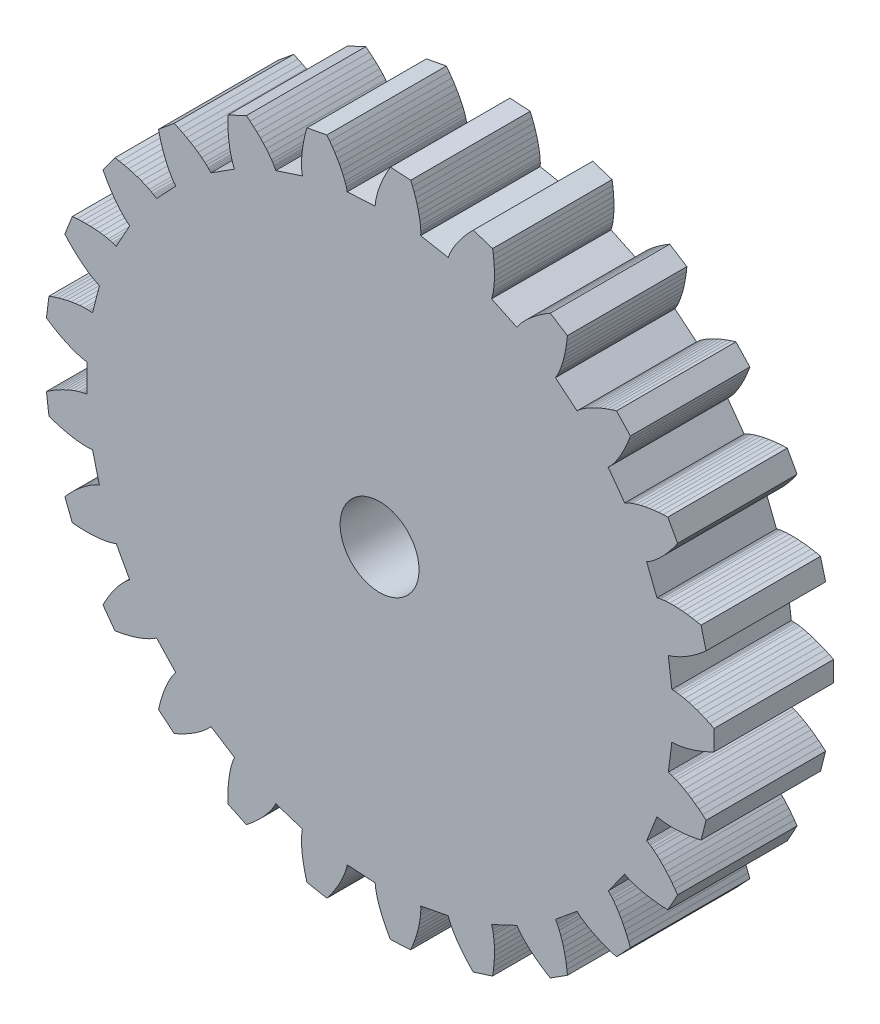
from build123d import *

# Parameters (mm, degrees)
MODEL_R             = 1.32
BOSS_EXTRUDE1_DEPTH = 4


with BuildPart() as part:
    # Model → Boss-Extrude1 (new body)
    with BuildSketch(Plane.XY):
        Polygon((22.5153116, 13.49371), (22.5501244, 13.4944492), (22.5850516, 13.4935692), (22.6200756, 13.4916244), (22.6551524, 13.4887996), (22.7254732, 13.4809588), (22.7959612, 13.4705748), (22.9373156, 13.4433212), (23.0790396, 13.4084996), (23.2209836, 13.3669196), (23.3630332, 13.319118), (23.5050916, 13.2654556), (23.6470444, 13.2062052), (23.7888124, 13.1415956), (23.93029, 13.071794), (23.93029, 12.391466), (23.7888124, 12.3216644), (23.6470444, 12.257046), (23.5050916, 12.1978044), (23.3630332, 12.144142), (23.2209836, 12.0963316), (23.0790396, 12.0547516), (22.9373156, 12.01993), (22.7959612, 11.9926764), (22.7254732, 11.9822924), (22.6551524, 11.9744516), (22.6200756, 11.9716356), (22.5850516, 11.969682), (22.5501244, 11.9688108), (22.5153116, 11.96955), (22.397462, 11.036662), (22.4313596, 11.0287244), (22.4649756, 11.0191852), (22.4984068, 11.00859), (22.5316884, 10.9971324), (22.5978468, 10.9720524), (22.6635388, 10.9444644), (22.7936732, 10.8829084), (22.9222852, 10.8139428), (23.0494276, 10.7383684), (23.1751356, 10.6567396), (23.299374, 10.569426), (23.4221428, 10.4767444), (23.5433804, 10.378906), (23.6630604, 10.2761132), (23.4938716, 9.6171516), (23.3394756, 9.5847324), (23.1860916, 9.5574084), (23.0338604, 9.5353204), (22.8829228, 9.5186708), (22.733446, 9.5076972), (22.5856236, 9.5027252), (22.4396932, 9.5042388), (22.295998, 9.5129948), (22.2251404, 9.5204748), (22.1550836, 9.5303572), (22.1204028, 9.53635), (22.0860036, 9.5431788), (22.0519476, 9.5510108), (22.0184196, 9.5603828), (21.6722716, 8.6861204), (21.7031332, 8.6699988), (21.7333172, 8.6523988), (21.76307, 8.633822), (21.7924532, 8.6144532), (21.8502868, 8.5737004), (21.9070556, 8.530642), (22.0178036, 8.4386644), (22.1252164, 8.3398756), (22.2295756, 8.2350588), (22.331022, 8.1247332), (22.4296524, 8.0092684), (22.5255108, 7.8889636), (22.6186148, 7.7640476), (22.7089732, 7.634714), (22.3812172, 7.0385404), (22.2236092, 7.0455364), (22.068254, 7.0572052), (21.91531, 7.0736788), (21.7649708, 7.0950892), (21.6174652, 7.12163), (21.4730484, 7.153574), (21.3320812, 7.1913348), (21.195074, 7.2355548), (21.1283084, 7.2604148), (21.0629068, 7.2874132), (21.0308044, 7.3018452), (20.999186, 7.3170076), (20.9681484, 7.3330676), (20.9379996, 7.3504828), (20.3853068, 6.5897668), (20.4111876, 6.566482), (20.4360564, 6.5419212), (20.4602476, 6.5165332), (20.4838844, 6.4904676), (20.5297764, 6.4366116), (20.5740492, 6.3807932), (20.6584412, 6.264158), (20.737914, 6.1417588), (20.8129252, 6.014282), (20.8837564, 5.882194), (20.950566, 5.7458292), (21.0134948, 5.6054604), (21.0726132, 5.4613164), (21.1279652, 5.313582), (20.6622428, 4.8176404), (20.5113228, 4.8636116), (20.3637556, 4.9135604), (20.2197172, 4.9675484), (20.0794276, 5.0256724), (19.9431508, 5.0880556), (19.8112124, 5.154918), (19.6840612, 5.22655), (19.562366, 5.3034532), (19.5038724, 5.3441356), (19.4472444, 5.3865516), (19.4197444, 5.4085076), (19.392878, 5.431062), (19.3668124, 5.454338), (19.3419436, 5.4787052), (18.6174308, 4.8793372), (18.6367116, 4.8503412), (18.65469, 4.8203684), (18.671806, 4.789762), (18.6882268, 4.7586364), (18.7192732, 4.6950564), (18.748278, 4.6299804), (18.8010076, 4.4960268), (18.8475508, 4.3577084), (18.888506, 4.2155796), (18.9242516, 4.0700276), (18.9550604, 3.921334), (18.9810996, 3.7697276), (19.00251, 3.6154108), (19.0193796, 3.4585508), (18.4449596, 3.0940108), (18.310214, 3.1760708), (18.1797012, 3.2611404), (18.0536148, 3.3492548), (17.9321836, 3.4404404), (17.8157068, 3.5347676), (17.7045452, 3.6323332), (17.5992092, 3.7333396), (17.5004468, 3.838086), (17.4539124, 3.8920388), (17.4096132, 3.947206), (17.3884316, 3.9753132), (17.3680332, 4.003834), (17.3485676, 4.0328564), (17.3305364, 4.0626444), (16.4797348, 3.6622884), (16.4911924, 3.6294116), (16.501154, 3.59591), (16.5101212, 3.5620124), (16.5182788, 3.5277716), (16.5325524, 3.4584716), (16.5444588, 3.38823), (16.5622172, 3.2453708), (16.5729004, 3.0998188), (16.5772212, 2.9519788), (16.575646, 2.802106), (16.5685092, 2.6504204), (16.5560308, 2.497098), (16.5383868, 2.342306), (16.515718, 2.1861764), (15.8686892, 1.9759444), (15.7585836, 2.0889364), (15.6533268, 2.203794), (15.5531124, 2.3204996), (15.458178, 2.439018), (15.368814, 2.5593404), (15.2854076, 2.6814932), (15.2084956, 2.8055204), (15.1388964, 2.9315364), (15.107234, 2.9953628), (15.0780444, 3.059814), (15.0645276, 3.0923036), (15.0518556, 3.1250044), (15.040222, 3.1579604), (15.0301724, 3.1912948), (14.1065244, 3.0151012), (14.1094548, 2.9804116), (14.110766, 2.9454844), (14.1110212, 2.9104164), (14.110414, 2.8752252), (14.1069996, 2.8045612), (14.1010596, 2.733554), (14.082738, 2.5907652), (14.0568836, 2.4471404), (14.024306, 2.3028644), (13.9855068, 2.1580868), (13.9408732, 2.0129484), (13.8906516, 1.867546), (13.8350708, 1.7220028), (13.7742892, 1.5764156), (13.0953076, 1.5337004), (13.0167588, 1.6705228), (12.9433668, 1.8079524), (12.8753252, 1.94591), (12.8128452, 2.0843076), (12.7562172, 2.2230836), (12.7058108, 2.3621324), (12.662154, 2.5013924), (12.6260828, 2.640758), (12.61129, 2.710454), (12.5990492, 2.7801412), (12.5940332, 2.8149716), (12.5898884, 2.849802), (12.5868172, 2.8846148), (12.585374, 2.9194012), (11.6469332, 2.9784404), (11.641134, 2.9441116), (11.6337244, 2.9099588), (11.62525, 2.8759292), (11.6159044, 2.8419964), (11.5950308, 2.7743948), (11.5716228, 2.7071012), (11.5183564, 2.57335), (11.4576012, 2.4406636), (11.390158, 2.3090244), (11.3165812, 2.17845), (11.2372492, 2.0489668), (11.1524524, 1.9206276), (11.0624196, 1.7934764), (10.9673444, 1.6675836), (10.2990636, 1.7950604), (10.2570084, 1.9471156), (10.22011, 2.0984756), (10.188518, 2.249026), (10.1624172, 2.3986172), (10.1420716, 2.5471084), (10.1278332, 2.6943324), (10.120186, 2.8400692), (10.1199044, 2.9840284), (10.122914, 3.0552116), (10.1283788, 3.1257524), (10.1321804, 3.1607412), (10.1368356, 3.1955012), (10.1425204, 3.2299884), (10.1497628, 3.2640444), (9.2554892, 3.5546116), (9.2413388, 3.5227996), (9.225666, 3.4915596), (9.2089988, 3.4607068), (9.1915132, 3.430162), (9.154474, 3.369882), (9.1150676, 3.3105172), (9.030218, 3.1942252), (8.9383724, 3.0808108), (8.840314, 2.9700804), (8.7365708, 2.861902), (8.62753, 2.756214), (8.513482, 2.6529988), (8.3946556, 2.55223), (8.2712532, 2.453934), (7.6556756, 2.7436036), (7.6527628, 2.9013436), (7.6546548, 3.05713), (7.6614924, 3.2108044), (7.6734164, 3.362182), (7.6906468, 3.5110692), (7.7134652, 3.6572108), (7.742294, 3.8002724), (7.7778196, 3.9397788), (7.798438, 4.0079788), (7.8212828, 4.0749468), (7.8336732, 4.1078852), (7.8468204, 4.1404012), (7.8608916, 4.1723804), (7.8763884, 4.2035676), (7.08247, 4.7074028), (7.0608484, 4.6801052), (7.0379068, 4.6537492), (7.0140852, 4.6280092), (6.9895508, 4.6027796), (6.938678, 4.5535964), (6.8857548, 4.5059004), (6.774646, 4.4143628), (6.6574828, 4.3273572), (6.5349692, 4.2444876), (6.4075804, 4.1655076), (6.275686, 4.0902588), (6.13955, 4.0186444), (5.9994012, 3.9506028), (5.8554332, 3.8860812), (5.331226, 4.3197364), (5.3676316, 4.4732436), (5.4082084, 4.623662), (5.4530444, 4.7708068), (5.5022452, 4.9144668), (5.5559604, 5.0543956), (5.6144012, 5.1902676), (5.6779108, 5.3216604), (5.7470084, 5.4479492), (5.783942, 5.5088804), (5.8227236, 5.5680604), (5.8429108, 5.5968892), (5.8637316, 5.6251108), (5.885318, 5.6525932), (5.9080836, 5.6789404), (5.2643988, 6.36439), (5.2366788, 6.3433316), (5.207894, 6.3235052), (5.1784228, 6.3044972), (5.1483884, 6.286158), (5.0868852, 6.2511692), (5.023754, 6.2181428), (4.8933732, 6.157106), (4.758258, 6.101974), (4.6189804, 6.0521748), (4.475954, 6.0073564), (4.3294868, 5.9672724), (4.1798164, 5.9317644), (4.027154, 5.9007092), (3.871658, 5.8740188), (3.4717684, 6.4244148), (3.5452044, 6.5640532), (3.6219228, 6.6996436), (3.7019412, 6.8310188), (3.7853212, 6.9579324), (3.872142, 7.0801028), (3.9625444, 7.197178), (4.0567308, 7.3086476), (4.1550708, 7.4137812), (4.2059964, 7.4636156), (4.2582684, 7.511294), (4.284994, 7.5341916), (4.3121772, 7.55635), (4.3399236, 7.577602), (4.3685236, 7.5974636), (3.9155348, 8.4214516), (3.8834412, 8.4079436), (3.8506348, 8.3959052), (3.817362, 8.384826), (3.783702, 8.37453), (3.7154316, 8.3559356), (3.6460788, 8.3396468), (3.50461, 8.3129476), (3.360026, 8.2931564), (3.2127404, 8.2795516), (3.0630612, 8.2717108), (2.9112348, 8.2693172), (2.7574372, 8.272142), (2.6018356, 8.2800268), (2.4445972, 8.2928484), (2.1941492, 8.9254012), (2.2999956, 9.0423884), (2.4080244, 9.15465), (2.5182004, 9.2619924), (2.6305236, 9.364178), (2.7450028, 9.4609252), (2.8616732, 9.5518292), (2.9806316, 9.6363796), (3.1020276, 9.713758), (3.163742, 9.7493628), (3.2262308, 9.7825388), (3.257814, 9.7980708), (3.2896524, 9.8127756), (3.3218076, 9.8264508), (3.3544468, 9.8385772), (3.1206044, 10.7493332), (3.0861612, 10.744238), (3.0513924, 10.7407356), (3.0164124, 10.7382716), (2.9812564, 10.7366788), (2.9105044, 10.7356404), (2.8392772, 10.73711), (2.6956172, 10.7464292), (2.550646, 10.7632196), (2.40461, 10.7866804), (2.2576852, 10.8163012), (2.1100212, 10.8517388), (1.9617588, 10.8927292), (1.8130124, 10.9390612), (1.6638964, 10.9905764), (1.5786332, 11.6655452), (1.7102548, 11.7525332), (1.8428004, 11.8343996), (1.9762172, 11.9109684), (2.1104172, 11.9820196), (2.2453652, 12.0472452), (2.3809732, 12.1062932), (2.5172148, 12.1586004), (2.654046, 12.2033572), (2.7226772, 12.2224884), (2.791458, 12.2390852), (2.8259012, 12.2462748), (2.8603972, 12.252602), (2.894946, 12.2578468), (2.9295828, 12.2614812), (2.9295828, 13.2017788), (2.894946, 13.2054044), (2.8603972, 13.210658), (2.8259012, 13.2169764), (2.791458, 13.224166), (2.7226772, 13.2407628), (2.654046, 13.2599028), (2.5172148, 13.3046596), (2.3809732, 13.3569668), (2.2453652, 13.416006), (2.1104172, 13.4812404), (1.9762172, 13.5522828), (1.8428004, 13.6288604), (1.7102548, 13.7107268), (1.5786332, 13.797706), (1.6638964, 14.4726748), (1.8130124, 14.5241988), (1.9617588, 14.5705308), (2.1100212, 14.6115124), (2.2576852, 14.64695), (2.40461, 14.6765796), (2.550646, 14.7000404), (2.6956172, 14.716822), (2.8392772, 14.7261412), (2.9105044, 14.7276108), (2.9812564, 14.7265812), (3.0164124, 14.7249796), (3.0513924, 14.7225244), (3.0861612, 14.7190132), (3.1206044, 14.713918), (3.3544468, 15.624674), (3.3218076, 15.6368004), (3.2896524, 15.6504844), (3.257814, 15.6651804), (3.2262308, 15.6807124), (3.163742, 15.7138972), (3.1020276, 15.7494932), (2.9806316, 15.8268716), (2.8616732, 15.911422), (2.7450028, 16.0023348), (2.6305236, 16.0990732), (2.5182004, 16.2012676), (2.4080244, 16.30861), (2.2999956, 16.4208716), (2.1941492, 16.5378588), (2.4445972, 17.1704116), (2.6018356, 17.1832244), (2.7574372, 17.1911092), (2.9112348, 17.1939428), (3.0630612, 17.1915404), (3.2127404, 17.1836996), (3.360026, 17.1701036), (3.50461, 17.1503124), (3.6460788, 17.1236132), (3.7154316, 17.1073156), (3.783702, 17.0887212), (3.817362, 17.078434), (3.8506348, 17.0673548), (3.8834412, 17.0553076), (3.9155348, 17.0418084), (4.3685236, 17.8657964), (4.3399236, 17.885658), (4.3121772, 17.9069012), (4.284994, 17.9290596), (4.2582684, 17.9519572), (4.2059964, 17.9996356), (4.1550708, 18.04947), (4.0567308, 18.1546036), (3.9625444, 18.266082), (3.872142, 18.3831484), (3.7853212, 18.5053188), (3.7019412, 18.6322324), (3.6219228, 18.7636076), (3.5452044, 18.8992068), (3.4717684, 19.0388364), (3.871658, 19.5892412), (4.027154, 19.5625508), (4.1798164, 19.5314868), (4.3294868, 19.4959788), (4.475954, 19.4559036), (4.6189804, 19.4110764), (4.758258, 19.361286), (4.8933732, 19.306154), (5.023754, 19.2451172), (5.0868852, 19.212082), (5.1483884, 19.1770932), (5.1784228, 19.158754), (5.207894, 19.1397548), (5.2366788, 19.1199284), (5.2643988, 19.09887), (5.9080836, 19.7843108), (5.885318, 19.8106668), (5.8637316, 19.8381404), (5.8429108, 19.866362), (5.8227236, 19.8951908), (5.783942, 19.9543708), (5.7470084, 20.015302), (5.6779108, 20.1415908), (5.6144012, 20.2729836), (5.5559604, 20.4088644), (5.5022452, 20.5487844), (5.4530444, 20.6924532), (5.4082084, 20.839598), (5.3676316, 20.9900076), (5.331226, 21.1435236), (5.8554332, 21.5771788), (5.9994012, 21.5126572), (6.13955, 21.4446068), (6.275686, 21.3729924), (6.4075804, 21.2977436), (6.5349692, 21.2187636), (6.6574828, 21.135894), (6.774646, 21.0488972), (6.8857548, 20.9573508), (6.938678, 20.9096548), (6.9895508, 20.8604804), (7.0140852, 20.835242), (7.0379068, 20.809502), (7.0608484, 20.783146), (7.08247, 20.7558572), (7.8763884, 21.2596924), (7.8608916, 21.2908708), (7.8468204, 21.3228588), (7.8336732, 21.355366), (7.8212828, 21.3883132), (7.798438, 21.4552724), (7.7778196, 21.5234724), (7.742294, 21.6629876), (7.7134652, 21.8060404), (7.6906468, 21.952182), (7.6734164, 22.1010692), (7.6614924, 22.2524556), (7.6546548, 22.40613), (7.6527628, 22.5619076), (7.6556756, 22.7196476), (8.2712532, 23.0093172), (8.3946556, 22.9110212), (8.513482, 22.8102612), (8.62753, 22.7070372), (8.7365708, 22.6013492), (8.840314, 22.4931708), (8.9383724, 22.3824404), (9.030218, 22.2690348), (9.1150676, 22.152734), (9.154474, 22.093378), (9.1915132, 22.0330892), (9.2089988, 22.0025532), (9.225666, 21.9716916), (9.2413388, 21.9404604), (9.2554892, 21.9086484), (10.1497628, 22.1992156), (10.1425204, 22.2332716), (10.1368356, 22.26775), (10.1321804, 22.30251), (10.1283788, 22.3374988), (10.122914, 22.4080396), (10.1199044, 22.4792228), (10.120186, 22.623182), (10.1278332, 22.7689188), (10.1420716, 22.9161428), (10.1624172, 23.064634), (10.188518, 23.214234), (10.22011, 23.3647756), (10.2570084, 23.5161356), (10.2990636, 23.6681908), (10.9673444, 23.7956764), (11.0624196, 23.6697748), (11.1524524, 23.5426324), (11.2372492, 23.4142932), (11.3165812, 23.28481), (11.390158, 23.1542268), (11.4576012, 23.0225876), (11.5183564, 22.8899012), (11.5716228, 22.7561588), (11.5950308, 22.6888652), (11.6159044, 22.6212636), (11.62525, 22.5873308), (11.6337244, 22.5533012), (11.641134, 22.5191484), (11.6469332, 22.4848108), (12.585374, 22.5438588), (12.5868172, 22.5786452), (12.5898884, 22.613458), (12.5940332, 22.6482796), (12.5990492, 22.68311), (12.61129, 22.7527972), (12.6260828, 22.8224932), (12.662154, 22.9618676), (12.7058108, 23.1011188), (12.7562172, 23.2401764), (12.8128452, 23.3789436), (12.8753252, 23.51735), (12.9433668, 23.6553076), (13.0167588, 23.7927372), (13.0953076, 23.9295596), (13.7742892, 23.8868356), (13.8350708, 23.7412484), (13.8906516, 23.5957052), (13.9408732, 23.4503116), (13.9855068, 23.3051644), (14.024306, 23.1603956), (14.0568836, 23.0161196), (14.082738, 22.872486), (14.1010596, 22.7296972), (14.1069996, 22.6586988), (14.110414, 22.588026), (14.1110212, 22.5528348), (14.110766, 22.5177668), (14.1094548, 22.4828484), (14.1065244, 22.44815), (15.0301724, 22.2719564), (15.040222, 22.3052908), (15.0518556, 22.3382468), (15.0645276, 22.3709476), (15.0780444, 22.4034372), (15.107234, 22.4678884), (15.1388964, 22.5317236), (15.2084956, 22.6577396), (15.2854076, 22.7817668), (15.368814, 22.9039108), (15.458178, 23.024242), (15.5531124, 23.1427604), (15.6533268, 23.2594572), (15.7585836, 23.3743236), (15.8686892, 23.4873068), (16.515718, 23.2770748), (16.5383868, 23.1209452), (16.5560308, 22.9661532), (16.5685092, 22.8128396), (16.575646, 22.661154), (16.5772212, 22.5112812), (16.5729004, 22.3634324), (16.5622172, 22.2178892), (16.5444588, 22.07503), (16.5325524, 22.0047796), (16.5182788, 21.9354796), (16.5101212, 21.9012476), (16.501154, 21.8673412), (16.4911924, 21.8338484), (16.4797348, 21.8009628), (17.3305364, 21.4006068), (17.3485676, 21.4303948), (17.3680332, 21.4594172), (17.3884316, 21.4879468), (17.4096132, 21.516054), (17.4539124, 21.5712212), (17.5004468, 21.625174), (17.5992092, 21.7299204), (17.7045452, 21.830918), (17.8157068, 21.9284924), (17.9321836, 22.0228108), (18.0536148, 22.1139964), (18.1797012, 22.2021108), (18.310214, 22.2871892), (18.4449596, 22.3692404), (19.0193796, 22.0047092), (19.00251, 21.8478404), (18.9810996, 21.6935236), (18.9550604, 21.541926), (18.9242516, 21.3932324), (18.888506, 21.2476716), (18.8475508, 21.1055428), (18.8010076, 20.9672332), (18.748278, 20.8332708), (18.7192732, 20.7681948), (18.6882268, 20.7046236), (18.671806, 20.6734892), (18.65469, 20.6428828), (18.6367116, 20.6129188), (18.6174308, 20.5839228), (19.3419436, 19.9845548), (19.3668124, 20.008922), (19.392878, 20.032198), (19.4197444, 20.0547436), (19.4472444, 20.0767084), (19.5038724, 20.1191244), (19.562366, 20.1598068), (19.6840612, 20.2367012), (19.8112124, 20.3083332), (19.9431508, 20.3751956), (20.0794276, 20.4375876), (20.2197172, 20.4957116), (20.3637556, 20.5496996), (20.5113228, 20.5996396), (20.6622428, 20.6456108), (21.1279652, 20.1496692), (21.0726132, 20.0019348), (21.0134948, 19.8577908), (20.950566, 19.7174308), (20.8837564, 19.581066), (20.8129252, 19.448978), (20.737914, 19.3215012), (20.6584412, 19.199102), (20.5740492, 19.0824668), (20.5297764, 19.0266484), (20.4838844, 18.9727924), (20.4602476, 18.946718), (20.4360564, 18.92133), (20.4111876, 18.896778), (20.3853068, 18.8734844), (20.9379996, 18.1127684), (20.9681484, 18.1301836), (20.999186, 18.1462436), (21.0308044, 18.161406), (21.0629068, 18.175838), (21.1283084, 18.2028452), (21.195074, 18.2277052), (21.3320812, 18.2719164), (21.4730484, 18.3096772), (21.6174652, 18.34163), (21.7649708, 18.3681708), (21.91531, 18.3895724), (22.068254, 18.406046), (22.2236092, 18.4177236), (22.3812172, 18.4247108), (22.7089732, 17.8285372), (22.6186148, 17.6992124), (22.5255108, 17.5742964), (22.4296524, 17.4539916), (22.331022, 17.3385268), (22.2295756, 17.2282012), (22.1252164, 17.1233844), (22.0178036, 17.0245956), (21.9070556, 16.9326092), (21.8502868, 16.8895508), (21.7924532, 16.8488068), (21.76307, 16.8294292), (21.7333172, 16.8108612), (21.7031332, 16.7932612), (21.6722716, 16.7771308), (22.0184196, 15.9028684), (22.0519476, 15.9122404), (22.0860036, 15.9200812), (22.1204028, 15.9269012), (22.1550836, 15.932894), (22.2251404, 15.9427852), (22.295998, 15.9502564), (22.4396932, 15.9590124), (22.5856236, 15.9605348), (22.733446, 15.9555628), (22.8829228, 15.9445804), (23.0338604, 15.9279308), (23.1860916, 15.9058516), (23.3394756, 15.8785276), (23.4938716, 15.8460996), (23.6630604, 15.1871468), (23.5433804, 15.084354), (23.4221428, 14.9865156), (23.299374, 14.8938252), (23.1751356, 14.8065204), (23.0494276, 14.7248828), (22.9222852, 14.6493172), (22.7936732, 14.5803428), (22.6635388, 14.5187868), (22.5978468, 14.4912076), (22.5316884, 14.4661188), (22.4984068, 14.4546612), (22.4649756, 14.4440748), (22.4313596, 14.4345356), (22.397462, 14.4265892), align=None)
        with Locations((12.73163, 12.73163)):
            Circle(MODEL_R, mode=Mode.SUBTRACT)
    extrude(amount=BOSS_EXTRUDE1_DEPTH)


solid = part.part
